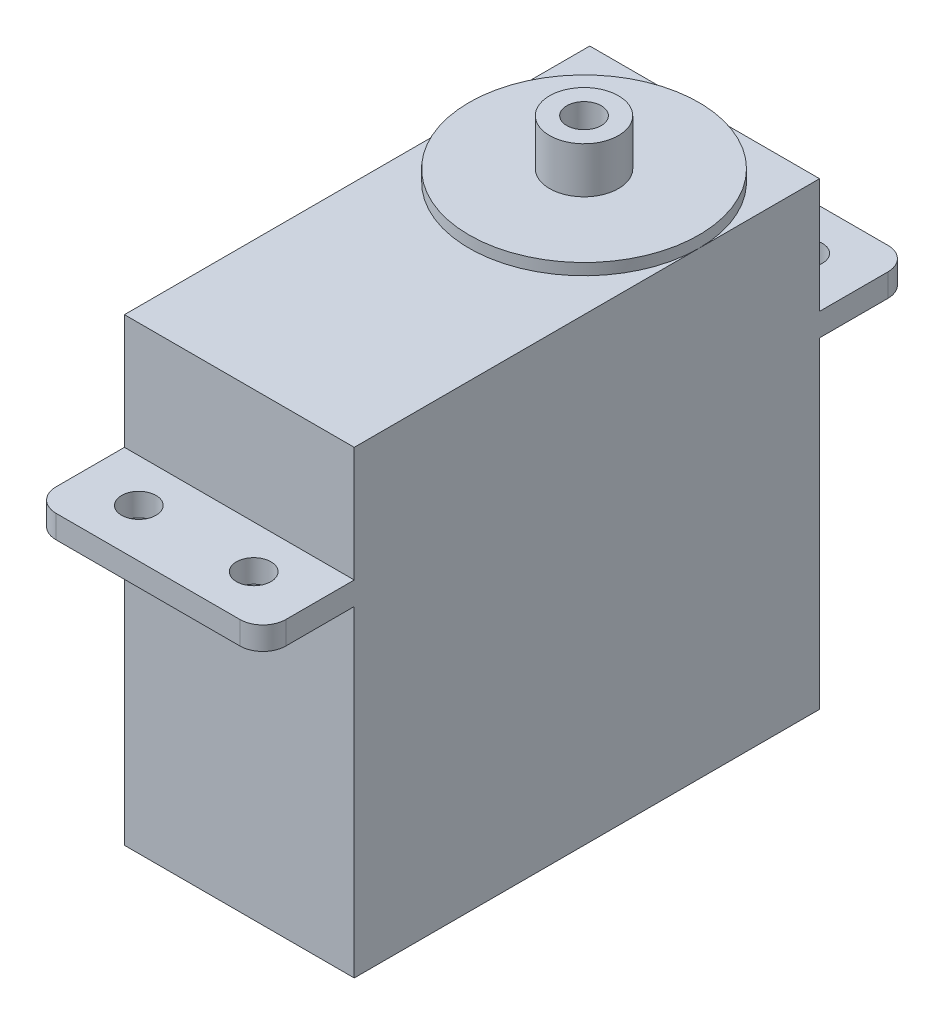
from build123d import *

# Parameters (mm, degrees)
SKETCH2_W           = 20
SKETCH2_H           = 40.5
BOSS_EXTRUDE1_DEPTH = 28
SKETCH3_W           = 20
SKETCH3_H           = 56.4
BOSS_EXTRUDE2_DEPTH = 2
SKETCH4_W           = 20
SKETCH4_H           = 40.5
BOSS_EXTRUDE3_DEPTH = 10
SKETCH5_R           = 10
BOSS_EXTRUDE4_DEPTH = 1
SKETCH6_R           = 3
SKETCH6_R_2         = 1.5
BOSS_EXTRUDE5_DEPTH = 4
SKETCH7_R           = 1.5
CUT_EXTRUDE1_DEPTH  = 2
FILLET1_R           = 2


with BuildPart() as part:
    # Sketch2 → Boss-Extrude1 (new body)
    with BuildSketch(Plane(origin=(0, 77, 0), x_dir=(1, 0, 0), z_dir=(0, 1, 0))):
        with Locations((-39.282617367, 276.14521975)):
            Rectangle(SKETCH2_W, SKETCH2_H)
    extrude(amount=BOSS_EXTRUDE1_DEPTH)

    # Sketch3 → Boss-Extrude2 (add)
    with BuildSketch(Plane(origin=(0, 105, 0), x_dir=(1, 0, 0), z_dir=(0, 1, 0))):
        with Locations((-39.282617367, 276.14521975)):
            Rectangle(SKETCH3_W, SKETCH3_H)
    extrude(amount=BOSS_EXTRUDE2_DEPTH)

    # Sketch4 → Boss-Extrude3 (add)
    with BuildSketch(Plane(origin=(0, 107, 0), x_dir=(1, 0, 0), z_dir=(0, 1, 0))):
        with Locations((-39.282617367, 276.14521975)):
            Rectangle(SKETCH4_W, SKETCH4_H)
    extrude(amount=BOSS_EXTRUDE3_DEPTH)

    # Sketch5 → Boss-Extrude4 (add)
    with BuildSketch(Plane(origin=(0, 117, 0), x_dir=(1, 0, 0), z_dir=(0, 1, 0))):
        with Locations((-39.282617367, 285.89521975)):
            Circle(SKETCH5_R)
    extrude(amount=BOSS_EXTRUDE4_DEPTH)

    # Sketch6 → Boss-Extrude5 (add)
    with BuildSketch(Plane(origin=(0, 118, 0), x_dir=(1, 0, 0), z_dir=(0, 1, 0))):
        with Locations((-39.282617367, 285.89521975)):
            Circle(SKETCH6_R)
        with Locations((-39.282617367, 285.89521975)):
            Circle(SKETCH6_R_2, mode=Mode.SUBTRACT)
    extrude(amount=BOSS_EXTRUDE5_DEPTH)

    # Sketch7 → Cut-Extrude1 (cut)
    with BuildSketch(Plane(origin=(0, 107, 0), x_dir=(1, 0, 0), z_dir=(0, 1, 0))):
        with Locations((-44.282617367, 252.14521975)):
            Circle(SKETCH7_R)
        with Locations((-34.282617367, 252.14521975)):
            Circle(SKETCH7_R)
        with Locations((-34.282617367, 300.14521975)):
            Circle(SKETCH7_R)
        with Locations((-44.282617367, 300.14521975)):
            Circle(SKETCH7_R)
    extrude(amount=-CUT_EXTRUDE1_DEPTH, mode=Mode.SUBTRACT)

    # Fillet1
    fillet1_edges = [part.edges().sort_by_distance(p)[0] for p in [
        (-29.282617367, 106, -304.34521975),
        (-49.282617367, 106, -304.34521975),
        (-49.282617367, 106, -247.94521975),
        (-29.282617367, 106, -247.94521975),
    ]]
    fillet(fillet1_edges, radius=FILLET1_R)


solid = part.part
